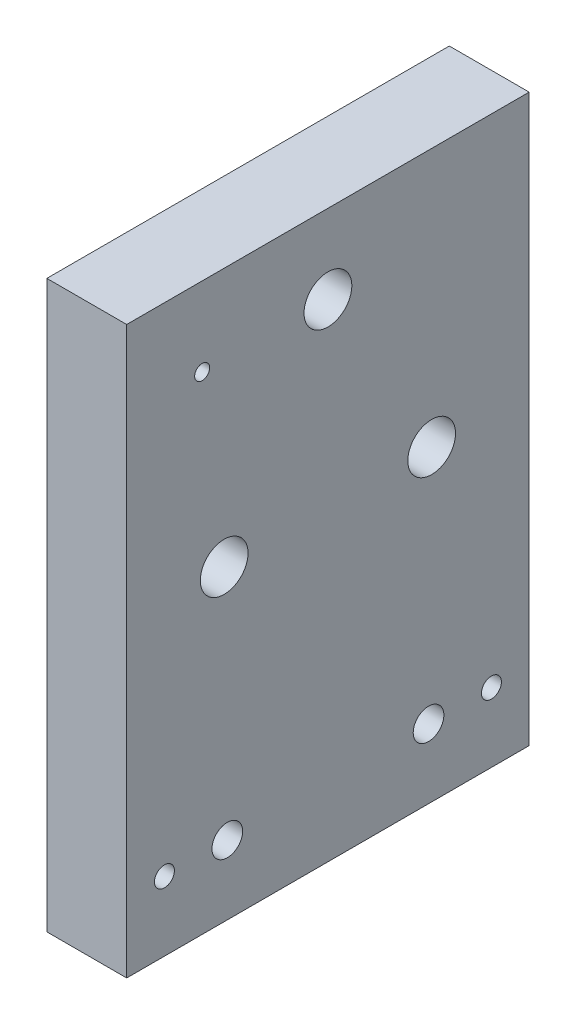
from build123d import *

# Parameters (mm, degrees)
SKETCH26_W                                          = 6.35
SKETCH26_H                                          = 32
BOSS_EXTRUDE2_DEPTH                                 = 45
CUT_EXTRUDE7_REACH                                  = 57.582
SKETCH27_R                                          = 1.595
CBORE_FOR_6_BINDING_HEAD_MACHINE_SCREW1_D           = 3.7973
CBORE_FOR_6_BINDING_HEAD_MACHINE_SCREW1_DEPTH       = 46.5
CBORE_FOR_6_BINDING_HEAD_MACHINE_SCREW1_CBORE_D     = 9.525
CBORE_FOR_6_BINDING_HEAD_MACHINE_SCREW1_CBORE_DEPTH = 1.016
CBORE_FOR_6_BINDING_HEAD_MACHINE_SCREW1_TIP         = 1.140824014
F_0_80_TAPPED_HOLE1_D                               = 1.19126
F_2_CLEARANCE_HOLE1_D                               = 2.4384
F_2_CLEARANCE_HOLE1_DEPTH                           = 20.32
F_2_CLEARANCE_HOLE1_TIP                             = 0.732569267
F_1_16_0_0625_DOWEL_HOLE1_D                         = 1.5875
F_1_16_0_0625_DOWEL_HOLE1_DEPTH                     = 3.523066884
F_1_16_0_0625_DOWEL_HOLE1_TIP                       = 0.476933116


with BuildPart() as part:
    # Sketch26 → Boss-Extrude2 (new body)
    with BuildSketch(Plane(origin=(0, 0, 0), x_dir=(-1, 0, 0), z_dir=(0, 1, 0))):
        with Locations((-3.175, 16)):
            Rectangle(SKETCH26_W, SKETCH26_H)
    extrude(amount=BOSS_EXTRUDE2_DEPTH)

    # Sketch27 → Cut-Extrude7 (cut, up to next)
    with BuildSketch(Plane.ZY, mode=Mode.PRIVATE) as cut_extrude7_sk1:
        with Locations((16, 38.725)):
            Circle(SKETCH27_R)
    cut_extrude7_tool1 = extrude(cut_extrude7_sk1.sketch, amount=-CUT_EXTRUDE7_REACH, mode=Mode.PRIVATE) & part.part
    # Sketch27 → Cut-Extrude7 (cut, up to next)
    with BuildSketch(Plane.ZY, mode=Mode.PRIVATE) as cut_extrude7_sk2:
        with Locations((24.248891971, 24.4375)):
            Circle(SKETCH27_R)
    cut_extrude7_tool2 = extrude(cut_extrude7_sk2.sketch, amount=-CUT_EXTRUDE7_REACH, mode=Mode.PRIVATE) & part.part
    # Sketch27 → Cut-Extrude7 (cut, up to next)
    with BuildSketch(Plane.ZY, mode=Mode.PRIVATE) as cut_extrude7_sk3:
        with Locations((7.751108029, 24.4375)):
            Circle(SKETCH27_R)
    cut_extrude7_tool3 = extrude(cut_extrude7_sk3.sketch, amount=-CUT_EXTRUDE7_REACH, mode=Mode.PRIVATE) & part.part
    add(cut_extrude7_tool1.solids().sort_by_distance((0, 38.725, 16))[0], mode=Mode.SUBTRACT)
    add(cut_extrude7_tool2.solids().sort_by_distance((0, 24.4375, 24.248892))[0], mode=Mode.SUBTRACT)
    add(cut_extrude7_tool3.solids().sort_by_distance((0, 24.4375, 7.751108))[0], mode=Mode.SUBTRACT)

    # CBORE for #6 Binding Head Machine Screw1
    with Locations(Plane.ZY):
        with Locations((16, 38.725), (24.248891971, 24.4375), (7.751108029, 24.4375)):
            CounterBoreHole(CBORE_FOR_6_BINDING_HEAD_MACHINE_SCREW1_D / 2, CBORE_FOR_6_BINDING_HEAD_MACHINE_SCREW1_CBORE_D / 2, CBORE_FOR_6_BINDING_HEAD_MACHINE_SCREW1_CBORE_DEPTH, depth=CBORE_FOR_6_BINDING_HEAD_MACHINE_SCREW1_DEPTH)
            with Locations((0, 0, -(CBORE_FOR_6_BINDING_HEAD_MACHINE_SCREW1_DEPTH + CBORE_FOR_6_BINDING_HEAD_MACHINE_SCREW1_TIP / 2))):  # 118° drill point
                Cone(0, CBORE_FOR_6_BINDING_HEAD_MACHINE_SCREW1_D / 2, CBORE_FOR_6_BINDING_HEAD_MACHINE_SCREW1_TIP, mode=Mode.SUBTRACT)

    # #0-80 Tapped Hole1 (through all)
    with Locations(Plane.ZY):
        with Locations((26, 38.725)):
            Hole(F_0_80_TAPPED_HOLE1_D / 2)

    # #2 Clearance Hole1
    with Locations(Plane.ZY):
        with Locations((8, 5.5), (24, 5.5)):
            Hole(F_2_CLEARANCE_HOLE1_D / 2, depth=F_2_CLEARANCE_HOLE1_DEPTH)
            with Locations((0, 0, -(F_2_CLEARANCE_HOLE1_DEPTH + F_2_CLEARANCE_HOLE1_TIP / 2))):  # 118° drill point
                Cone(0, F_2_CLEARANCE_HOLE1_D / 2, F_2_CLEARANCE_HOLE1_TIP, mode=Mode.SUBTRACT)

    # 1/16 (0.0625) Dowel Hole1
    with Locations(Plane(origin=(6.35, 0, 0), x_dir=(0, 0, -1), z_dir=(1, 0, 0))):
        with Locations((-29, 5.5), (-3, 5.5)):
            Hole(F_1_16_0_0625_DOWEL_HOLE1_D / 2, depth=F_1_16_0_0625_DOWEL_HOLE1_DEPTH)
            with Locations((0, 0, -(F_1_16_0_0625_DOWEL_HOLE1_DEPTH + F_1_16_0_0625_DOWEL_HOLE1_TIP / 2))):  # 118° drill point
                Cone(0, F_1_16_0_0625_DOWEL_HOLE1_D / 2, F_1_16_0_0625_DOWEL_HOLE1_TIP, mode=Mode.SUBTRACT)


solid = part.part
